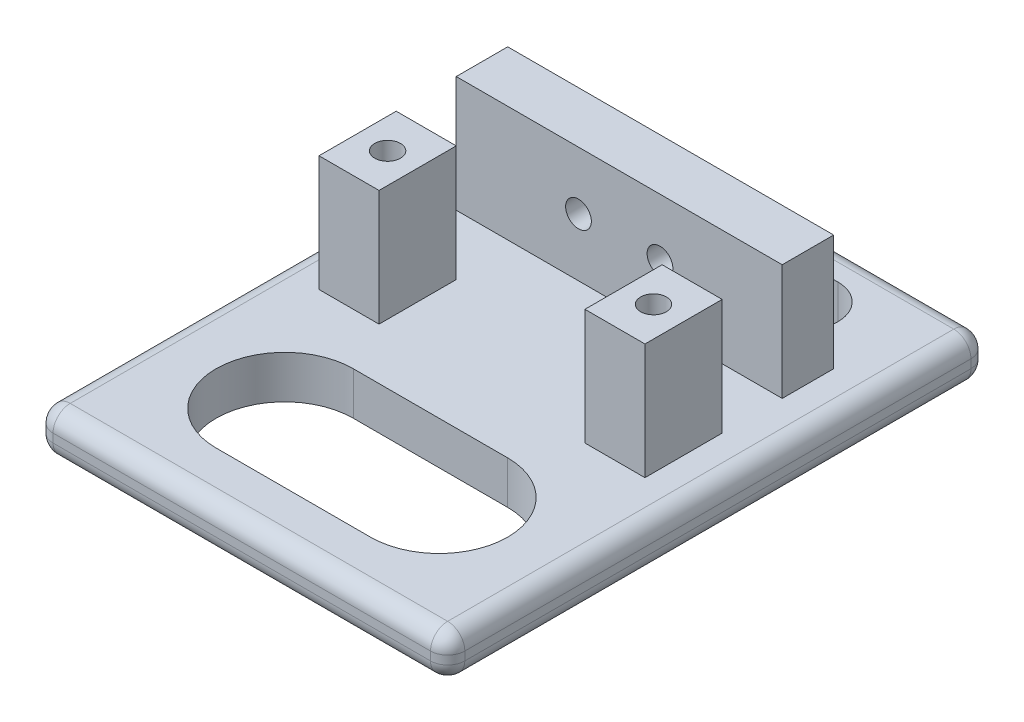
from build123d import *

# Parameters (mm, degrees)
CROQUIS1_W              = 48
CROQUIS1_H              = 63
SALIENTE_EXTRUIR1_DEPTH = 5
CROQUIS2_W              = 7
CROQUIS2_H              = 9
CROQUIS2_W_2            = 38
CROQUIS2_H_2            = 6
SALIENTE_EXTRUIR2_DEPTH = 13.5
CORTAR_EXTRUIR1_REACH   = 53.906
CROQUIS3_R              = 1.5
REDONDEO1_R             = 2
CROQUIS4_R              = 1.5
CORTAR_EXTRUIR2_DEPTH   = 10


with BuildPart() as part:
    # Croquis1 → Saliente-Extruir1 (new body)
    with BuildSketch(Plane(origin=(0, 0, 0), x_dir=(1, 0, 0), z_dir=(0, 1, 0))):
        Rectangle(CROQUIS1_W, CROQUIS1_H)
        with BuildLine():
            Line((-9, -9.5), (9, -9.5))
            ThreePointArc((9, -9.5), (17, -17.5), (9, -25.5))
            Line((9, -25.5), (-9, -25.5))
            ThreePointArc((-9, -25.5), (-17, -17.5), (-9, -9.5))
        make_face(mode=Mode.SUBTRACT)
        with BuildLine():
            Line((-10.5, 27.5), (10.5, 27.5))
            ThreePointArc((10.5, 27.5), (14.5, 23.5), (10.5, 19.5))
            Line((10.5, 19.5), (-10.5, 19.5))
            ThreePointArc((-10.5, 19.5), (-14.5, 23.5), (-10.5, 27.5))
        make_face(mode=Mode.SUBTRACT)
    extrude(amount=-SALIENTE_EXTRUIR1_DEPTH)

    # Croquis2 → Saliente-Extruir2 (add)
    with BuildSketch(Plane(origin=(0, 0, 0), x_dir=(1, 0, 0), z_dir=(0, 1, 0))):
        with Locations((15.5, 1)):
            Rectangle(CROQUIS2_W, CROQUIS2_H)
        with Locations((-15.5, 1)):
            Rectangle(CROQUIS2_W, CROQUIS2_H)
        with Locations((0, 15.5)):
            Rectangle(CROQUIS2_W_2, CROQUIS2_H_2)
    extrude(amount=SALIENTE_EXTRUIR2_DEPTH)

    # Croquis3 → Cortar-Extruir1 (cut, up to next)
    with BuildSketch(Plane.XY.offset(-12.5), mode=Mode.PRIVATE) as cortar_extruir1_sk1:
        with Locations((4.75, 6.75)):
            Circle(CROQUIS3_R)
    cortar_extruir1_tool1 = extrude(cortar_extruir1_sk1.sketch, amount=-CORTAR_EXTRUIR1_REACH, mode=Mode.PRIVATE) & part.part
    # Croquis3 → Cortar-Extruir1 (cut, up to next)
    with BuildSketch(Plane.XY.offset(-12.5), mode=Mode.PRIVATE) as cortar_extruir1_sk2:
        with Locations((-4.75, 6.75)):
            Circle(CROQUIS3_R)
    cortar_extruir1_tool2 = extrude(cortar_extruir1_sk2.sketch, amount=-CORTAR_EXTRUIR1_REACH, mode=Mode.PRIVATE) & part.part
    add(cortar_extruir1_tool1.solids().sort_by_distance((4.75, 6.75, -12.5))[0], mode=Mode.SUBTRACT)
    add(cortar_extruir1_tool2.solids().sort_by_distance((-4.75, 6.75, -12.5))[0], mode=Mode.SUBTRACT)

    # Redondeo1
    redondeo1_edges = [part.edges().sort_by_distance(p)[0] for p in [
        (0, -5, -31.5),
        (0, 0, -31.5),
        (-24, -5, 0),
        (-24, -2.5, -31.5),
        (-24, 0, 0),
        (0, -5, 31.5),
        (-24, -2.5, 31.5),
        (0, 0, 31.5),
        (24, -2.5, -31.5),
        (24, -5, 0),
        (24, -2.5, 31.5),
        (24, 0, 0),
    ]]
    fillet(redondeo1_edges, radius=REDONDEO1_R)

    # Croquis4 → Cortar-Extruir2 (cut)
    with BuildSketch(Plane(origin=(0, 13.5, 0), x_dir=(1, 0, 0), z_dir=(0, 1, 0))):
        with Locations((-15.5, 1)):
            Circle(CROQUIS4_R)
        with Locations((15.5, 1)):
            Circle(CROQUIS4_R)
    extrude(amount=-CORTAR_EXTRUIR2_DEPTH, mode=Mode.SUBTRACT)


solid = part.part
